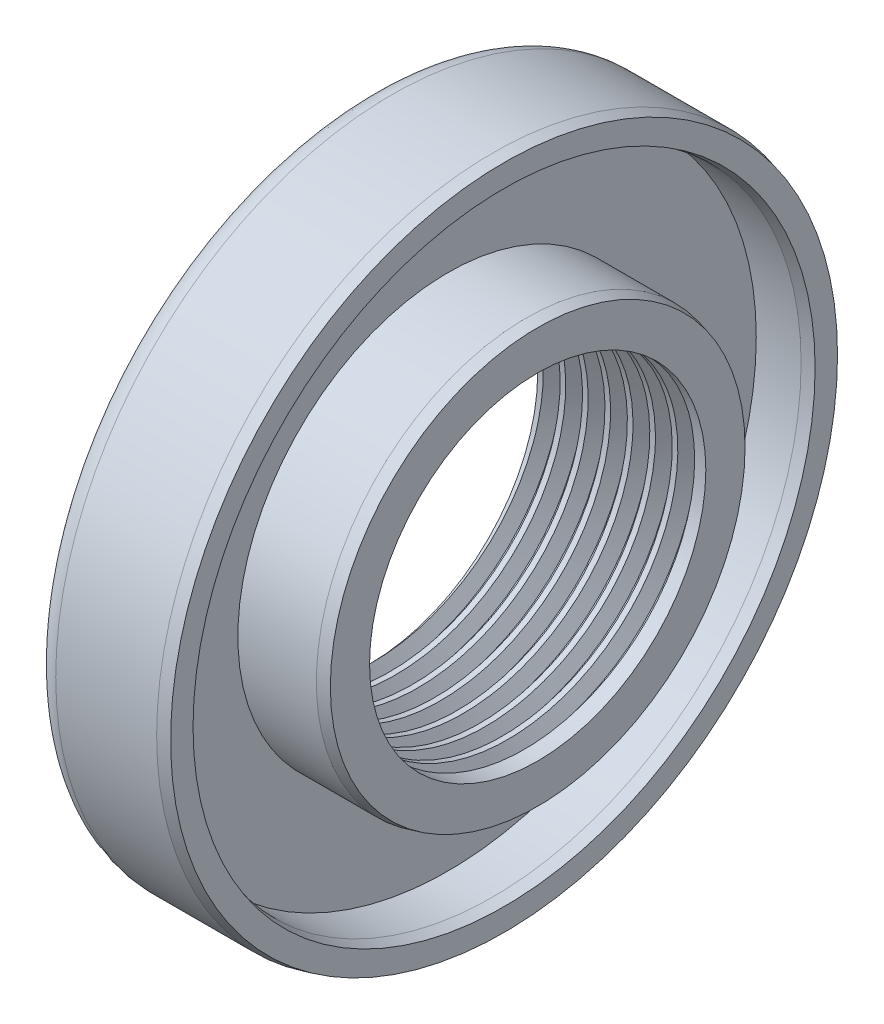
from build123d import *

# Parameters (mm, degrees)
DI_1_PITCH = 4


with BuildPart() as part:
    # Çizim1 → Döndür1 (revolve)
    with BuildSketch(Plane.XY, mode=Mode.PRIVATE) as d_nd_r1_sk:
        with BuildLine():
            Line((0, 30), (-30, 30))
            Line((-30, 30), (-30, 56))
            ThreePointArc((-30, 56), (-28.828427125, 58.828427125), (-26, 60))
            Line((-26, 60), (-8, 60))
            Line((-8, 60), (-6, 59.5))
            Line((-6, 59.5), (-6, 55.5))
            Line((-6, 55.5), (-8, 55))
            Line((-8, 55), (-16, 55))
            Line((-16, 55), (-16, 37.5))
            Line((-16, 37.5), (-2, 37.5))
            Line((-2, 37.5), (0, 37))
            Line((0, 37), (0, 30))
        make_face()
    revolve(d_nd_r1_sk.sketch.rotate(Axis((0, 0, 0), (-1, 0, 0)), 90), axis=Axis((0, 0, 0), (-1, 0, 0)))

    # Diş1: the profile of Diş Profili2 profile screwed along a right-hand helix of 12.5 turns, 12 arcs to a turn; built about Z, then put on its axis
    di_1_z = Axis((0, 0, 0), (0, 0, 1))
    di_1_corners = [(29.9997, 0, -0.000173205), (32.1650635, 0, 1.249999995), (32.1650635, 0, 1.749999995), (29.9997, 0, 3.000173194)]
    with BuildLine(mode=Mode.PRIVATE) as di_1_profile:
        Line(di_1_corners[0], di_1_corners[1])
        Line(di_1_corners[1], di_1_corners[2])
        Line(di_1_corners[2], di_1_corners[3])
        Line(di_1_corners[3], di_1_corners[0])
    di_1_cap = Face(di_1_profile.wire())
    di_1_turn_angles = [0, 15, 30, 45, 60, 75, 90, 105, 120, 135, 150, 165, 180, 195, 210, 225, 240, 255, 270, 285, 300, 315, 330, 345, 360]
    di_1_turn_weights = [1, 0.9659258262890683, 1, 0.9659258262890683, 1, 0.9659258262890683, 1, 0.9659258262890683, 1, 0.9659258262890683, 1, 0.9659258262890683, 1, 0.9659258262890683, 1, 0.9659258262890683, 1, 0.9659258262890683, 1, 0.9659258262890683, 1, 0.9659258262890683, 1, 0.9659258262890683, 1]
    di_1_turn_rails = [Edge.make_bspline([Vector(p[0], p[1], 0).rotate(di_1_z, di_1_turn_angles[k]) / di_1_turn_weights[k] + Vector(0, 0, p[2] + DI_1_PITCH * di_1_turn_angles[k] / 360) for k in range(25)], [0, 0, 0, 1, 1, 2, 2, 3, 3, 4, 4, 5, 5, 6, 6, 7, 7, 8, 8, 9, 9, 10, 10, 11, 11, 12, 12, 12], 2, di_1_turn_weights) for p in di_1_corners]
    di_1_turn_sides = [Face.make_surface_from_curves(di_1_turn_rails[p[0]], di_1_turn_rails[p[1]]) for p in [(0, 1), (1, 2), (2, 3), (3, 0)]]
    di_1_last_angles = [4320, 4335, 4350, 4365, 4380, 4395, 4410, 4425, 4440, 4455, 4470, 4485, 4500]
    di_1_last_weights = [1, 0.9659258262890683, 1, 0.9659258262890683, 1, 0.9659258262890683, 1, 0.9659258262890683, 1, 0.9659258262890683, 1, 0.9659258262890683, 1]
    di_1_last_rails = [Edge.make_bspline([Vector(p[0], p[1], 0).rotate(di_1_z, di_1_last_angles[k]) / di_1_last_weights[k] + Vector(0, 0, p[2] + DI_1_PITCH * di_1_last_angles[k] / 360) for k in range(13)], [0, 0, 0, 1, 1, 2, 2, 3, 3, 4, 4, 5, 5, 6, 6, 6], 2, di_1_last_weights) for p in di_1_corners]
    di_1_last_sides = [Face.make_surface_from_curves(di_1_last_rails[p[0]], di_1_last_rails[p[1]]) for p in [(0, 1), (1, 2), (2, 3), (3, 0)]]
    di_1 = Plane(origin=(0, 0, 0), x_dir=(0, 0, 1), z_dir=(-1, 0, 0)) * Solid(Shell([*[p.moved(Location((0, 0, DI_1_PITCH * i))) for i in range(12) for p in di_1_turn_sides], *di_1_last_sides, di_1_cap, di_1_cap.rotate(di_1_z, 4500).moved(Location((0, 0, DI_1_PITCH * 4500 / 360)))]))
    add(di_1, mode=Mode.SUBTRACT)


solid = part.part
